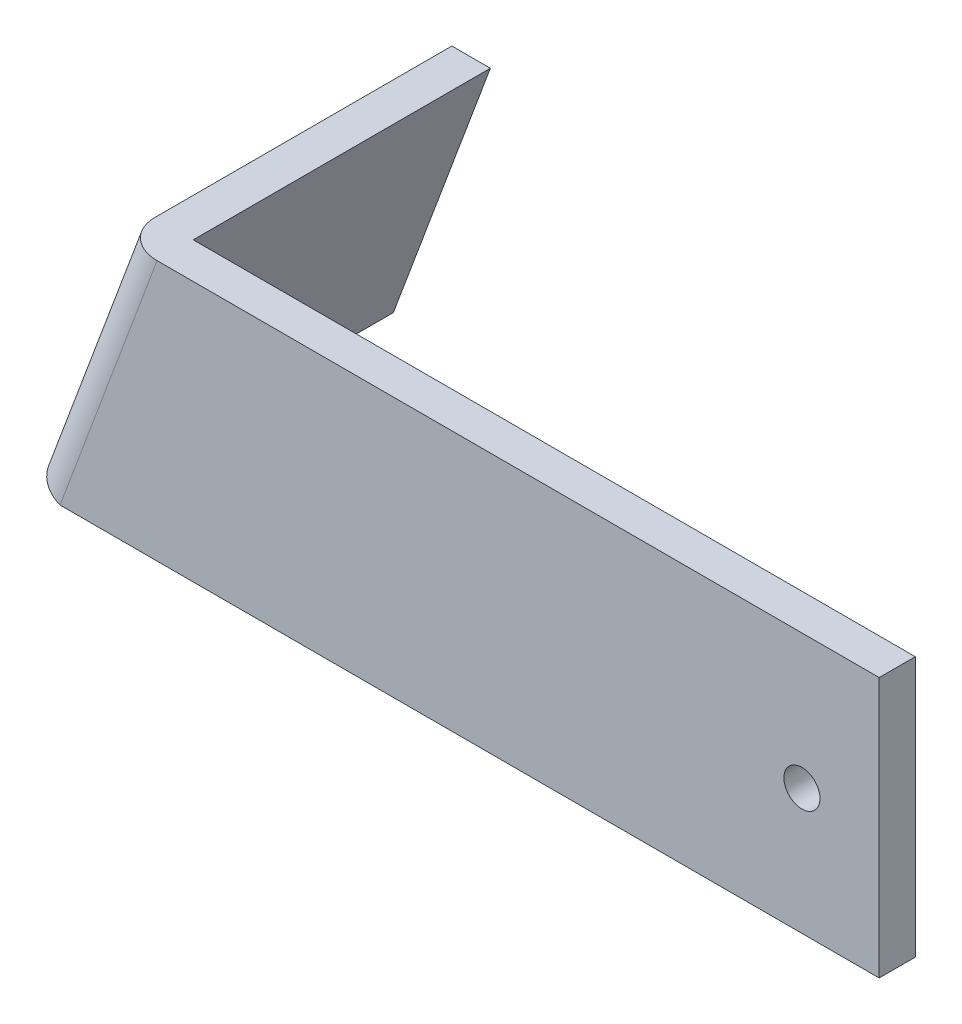
from build123d import *

# Parameters (mm, degrees)
SKETCH13_R              = 1.651
BASE_FLANGE5_DEPTH      = 3.302
EDGE_FLANGE4_START      = -48.484504913
EDGE_FLANGE4_DEPTH      = 25.4
CUT_EXTRUDE4_DEPTH      = 4.699
CUT_EXTRUDE4_DEPTH_BACK = 36.068


# Read off the part's stored shape, not the designer's step: Edge-Flange4
# Sheet-metal steps are written as plain solids
with BuildPart() as part:
    # Sketch13 → Base-Flange5 (new body)
    with BuildSketch(Plane.XY):
        Polygon((-66.04, 0), (0, 0), (0, -23.797677877), (-74.918655736, -23.797677877), align=None)
        with Locations((-7.065339848, -12.296727665)):
            Circle(SKETCH13_R, mode=Mode.SUBTRACT)
    extrude(amount=-BASE_FLANGE5_DEPTH)

    # Edge-Flange4 outline → Edge-Flange4 (add)
    with BuildSketch(Plane(origin=(0, 0, 0), x_dir=(0.9369164518419233, -0.34955337542060905, 0), z_dir=(0.34955337542060905, 0.9369164518419232, 0)).offset(EDGE_FLANGE4_START)):
        with BuildLine():
            ThreePointArc((-65.17596248, 3.302), (-64.208829071, 0.967133409), (-61.87396248, 0))
            Line((-61.87396248, 0), (-61.87396248, 30.48))
            Line((-61.87396248, 30.48), (-65.17596248, 30.48))
            Line((-65.17596248, 30.48), (-65.17596248, 3.302))
        make_face()
    extrude(amount=EDGE_FLANGE4_DEPTH)

    # Sketch51 → Cut-Extrude4 (cut, two sides: drawn at the far end of the back side and taken through both)
    with BuildSketch(Plane.XY.offset(-CUT_EXTRUDE4_DEPTH_BACK)):
        Polygon((-66.04, 0), (-69.564327056, 0), (-69.133698124, 1.154225246), align=None)
    extrude(amount=CUT_EXTRUDE4_DEPTH + CUT_EXTRUDE4_DEPTH_BACK, mode=Mode.SUBTRACT)


solid = part.part
